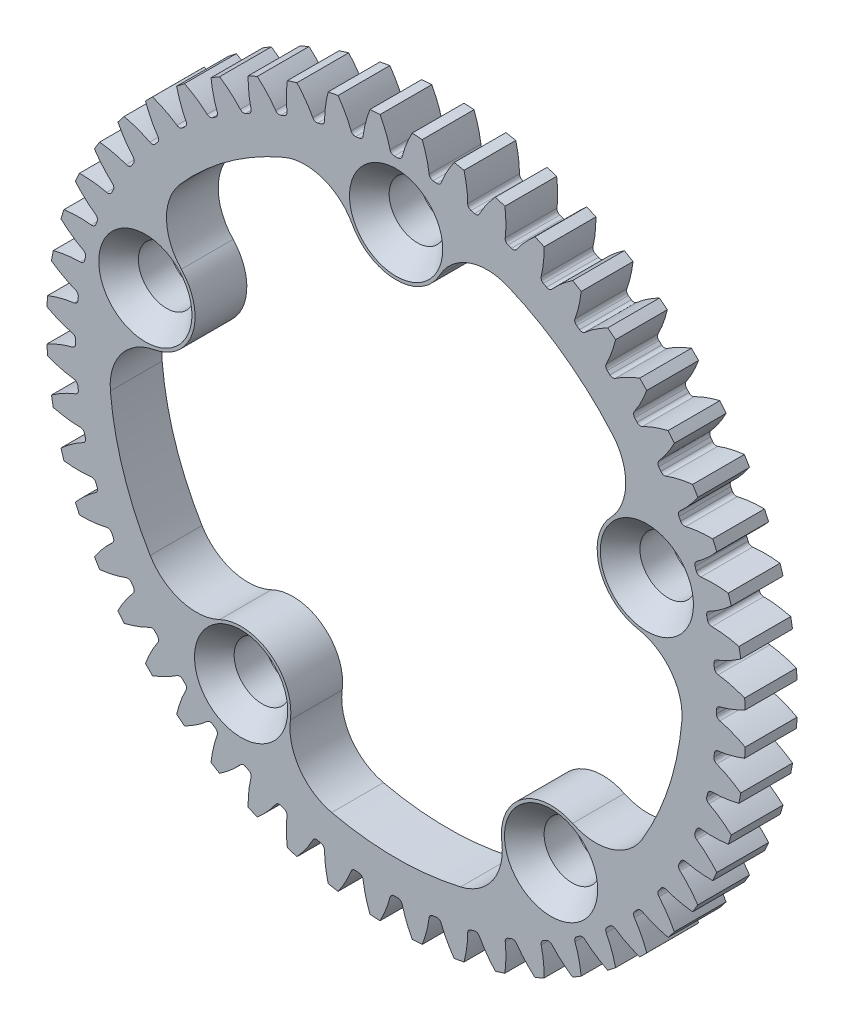
from build123d import *

# Parameters (mm, degrees)
SKETCH1_R                                     = 21.43125
BOSS_EXTRUDE1_DEPTH                           = 3.175
CUT_EXTRUDE1_REACH                            = 32.474
FILLET1_R                                     = 0.266307122
CIRPATTERN1_COUNT                             = 52
FILLET1_OF_CIRPATTERN1_R                      = 0.266307122
CUT_EXTRUDE2_REACH                            = 32.442
CSK_FOR_4_FLAT_HEAD_MACHINE_SCREW1_AT_2_COUNT = 2
CSK_FOR_4_FLAT_HEAD_MACHINE_SCREW1_AT_2_PITCH = 19.005565905
CSK_FOR_4_FLAT_HEAD_MACHINE_SCREW1_AT_3_COUNT = 2
CSK_FOR_4_FLAT_HEAD_MACHINE_SCREW1_AT_3_PITCH = 30.751651609
CSK_FOR_4_FLAT_HEAD_MACHINE_SCREW1_AT_4_COUNT = 2
CSK_FOR_4_FLAT_HEAD_MACHINE_SCREW1_AT_4_PITCH = 30.751651609
CSK_FOR_4_FLAT_HEAD_MACHINE_SCREW1_AT_5_COUNT = 2
CSK_FOR_4_FLAT_HEAD_MACHINE_SCREW1_AT_5_PITCH = 19.005565905


with BuildPart() as part:
    # Sketch1 → Boss-Extrude1 (new body)
    with BuildSketch(Plane.XY):
        Circle(SKETCH1_R)
    extrude(amount=-BOSS_EXTRUDE1_DEPTH)

    # Sketch2 → Cut-Extrude1 (cut, up to next)
    with BuildSketch(Plane.XY, mode=Mode.PRIVATE) as cut_extrude1_sk1:
        with BuildLine():
            ThreePointArc((19.642574739, 0.327964689), (19.642798219, 0.314294998), (19.643012186, 0.300625155))
            ThreePointArc((19.643012186, 0.300625155), (19.644737413, 0.150316978), (19.6453125, 0))
            ThreePointArc((19.6453125, 0), (19.644737413, -0.150316978), (19.643012186, -0.300625155))
            ThreePointArc((19.643012186, -0.300625155), (19.642798219, -0.314294998), (19.642574739, -0.327964689))
            add(Edge.make_bspline(
                [(19.642574739, -0.327964689), (19.65835543, -0.33079196), (19.704727828, -0.339425059), (19.796499822, -0.358275647), (19.933064852, -0.390982616), (20.097906156, -0.436744542), (20.275912073, -0.492991017), (20.430610013, -0.54721969), (20.54031096, -0.588677295), (20.605948953, -0.614496658), (20.628084749, -0.623318401)],
                knots=[0.037216085, 0.037216085, 0.037216085, 0.037216085, 0.037216085, 0.046610139, 0.064854849, 0.092110525, 0.119476176, 0.146842496, 0.174208854, 0.188172962, 0.188172962, 0.188172962, 0.188172962, 0.188172962], degree=4))
            ThreePointArc((20.628084749, -0.623318401), (20.635146053, -0.311694753), (20.6375, 0))
            ThreePointArc((20.6375, 0), (20.635146053, 0.311694753), (20.628084749, 0.623318401))
            add(Edge.make_bspline(
                [(19.642574739, 0.327964689), (19.65835543, 0.33079196), (19.704727828, 0.339425059), (19.796499822, 0.358275647), (19.933064852, 0.390982616), (20.097906156, 0.436744542), (20.275912073, 0.492991017), (20.430610013, 0.54721969), (20.54031096, 0.588677295), (20.605948953, 0.614496658), (20.628084749, 0.623318401)],
                knots=[0.037216085, 0.037216085, 0.037216085, 0.037216085, 0.037216085, 0.046610139, 0.064854849, 0.092110525, 0.119476176, 0.146842496, 0.174208854, 0.188172962, 0.188172962, 0.188172962, 0.188172962, 0.188172962], degree=4))
        make_face()
    cut_extrude1_tool1 = extrude(cut_extrude1_sk1.sketch, amount=-CUT_EXTRUDE1_REACH, mode=Mode.PRIVATE) & part.part
    # Sketch2 → Cut-Extrude1 (cut, up to next)
    with BuildSketch(Plane.XY, mode=Mode.PRIVATE) as cut_extrude1_sk2:
        with BuildLine():
            add(Edge.make_bspline(
                [(20.628084749, 0.623318401), (20.649329486, 0.631785031), (20.713839892, 0.657815411), (20.821075484, 0.702694452), (21.006667214, 0.78497796), (21.179989773, 0.867942113), (21.309988998, 0.933914245), (21.397615643, 0.979985824), (21.408566897, 0.985768727)],
                knots=[0.188172962, 0.188172962, 0.188172962, 0.188172962, 0.188172962, 0.201574956, 0.228941013, 0.256307345, 0.307035032, 0.314288545, 0.314288545, 0.314288545, 0.314288545, 0.314288545], degree=4))
            ThreePointArc((20.628084749, 0.623318401), (20.635146053, 0.311694753), (20.6375, 0))
            ThreePointArc((20.6375, 0), (20.635146053, -0.311694753), (20.628084749, -0.623318401))
            add(Edge.make_bspline(
                [(20.628084749, -0.623318401), (20.649329486, -0.631785031), (20.713839892, -0.657815411), (20.821075484, -0.702694452), (21.006667214, -0.78497796), (21.179989773, -0.867942113), (21.309988998, -0.933914245), (21.397615643, -0.979985824), (21.408566897, -0.985768727)],
                knots=[0.188172962, 0.188172962, 0.188172962, 0.188172962, 0.188172962, 0.201574956, 0.228941013, 0.256307345, 0.307035032, 0.314288545, 0.314288545, 0.314288545, 0.314288545, 0.314288545], degree=4))
            ThreePointArc((21.408566897, -0.985768727), (21.425578474, -0.493014834), (21.43125, 0))
            ThreePointArc((21.43125, 0), (21.425578474, 0.493014834), (21.408566897, 0.985768727))
        make_face()
    cut_extrude1_tool2 = extrude(cut_extrude1_sk2.sketch, amount=-CUT_EXTRUDE1_REACH, mode=Mode.PRIVATE) & part.part
    cut_extrude1_1 = cut_extrude1_tool1.solids().sort_by_distance((20.193172, 0, 0))[0]
    add(cut_extrude1_1, mode=Mode.SUBTRACT)
    cut_extrude1_2 = cut_extrude1_tool2.solids().sort_by_distance((21.059239, 0, 0))[0]
    add(cut_extrude1_2, mode=Mode.SUBTRACT)
    cut_extrude1 = cut_extrude1_1 + cut_extrude1_2  # Cut-Extrude1 as one shape, for the pattern or mirror that repeats it

    # Fillet1
    fillet1_edges = [part.edges().sort_by_distance(p)[0] for p in [
        (19.642574739, -0.327964689, -1.5875),
        (19.642574739, 0.327964689, -1.5875),
    ]]
    fillet(fillet1_edges, radius=FILLET1_R)

    # CirPattern1: Cut-Extrude1 ×52 about axis
    cirpattern1_axis = Axis((0, 0, 0), (0, 0, 1))
    for i in range(1, CIRPATTERN1_COUNT):
        add(cut_extrude1.rotate(cirpattern1_axis, i * 360 / CIRPATTERN1_COUNT), mode=Mode.SUBTRACT)

    # Fillet1 of CirPattern1
    fillet1_of_cirpattern1_edges = [part.edges().sort_by_distance(p)[0] for p in [
        (19.538890029, 2.042077294, -1.5875),
        (19.459826479, 2.693224208, -1.5875),
        (19.150284304, 4.382341191, -1.5875),
        (18.993310129, 5.019210453, -1.5875),
        (18.482424311, 6.658700686, -1.5875),
        (18.249828548, 7.272005308, -1.5875),
        (17.545048953, 8.83796133, -1.5875),
        (17.240223372, 9.41875795, -1.5875),
        (16.351827273, 10.888344597, -1.5875),
        (15.979216917, 11.428163892, -1.5875),
        (14.92015913, 12.779951281, -1.5875),
        (14.485197498, 13.27092147, -1.5875),
        (13.27092147, 14.485197498, -1.5875),
        (12.779951281, 14.92015913, -1.5875),
        (11.428163892, 15.979216917, -1.5875),
        (10.888344597, 16.351827273, -1.5875),
        (9.41875795, 17.240223372, -1.5875),
        (8.83796133, 17.545048953, -1.5875),
        (7.272005308, 18.249828548, -1.5875),
        (6.658700686, 18.482424311, -1.5875),
        (5.019210453, 18.993310129, -1.5875),
        (4.382341191, 19.150284304, -1.5875),
        (2.693224208, 19.459826479, -1.5875),
        (2.042077294, 19.538890029, -1.5875),
        (0.327964689, 19.642574739, -1.5875),
        (-0.327964689, 19.642574739, -1.5875),
        (-2.042077294, 19.538890029, -1.5875),
        (-2.693224208, 19.459826479, -1.5875),
        (-4.382341191, 19.150284304, -1.5875),
        (-5.019210453, 18.993310129, -1.5875),
        (-6.658700686, 18.482424311, -1.5875),
        (-7.272005308, 18.249828548, -1.5875),
        (-8.83796133, 17.545048953, -1.5875),
        (-9.41875795, 17.240223372, -1.5875),
        (-10.888344597, 16.351827273, -1.5875),
        (-11.428163892, 15.979216917, -1.5875),
        (-12.779951281, 14.92015913, -1.5875),
        (-13.27092147, 14.485197498, -1.5875),
        (-14.485197498, 13.27092147, -1.5875),
        (-14.92015913, 12.779951281, -1.5875),
        (-15.979216917, 11.428163892, -1.5875),
        (-16.351827273, 10.888344597, -1.5875),
        (-17.240223372, 9.41875795, -1.5875),
        (-17.545048953, 8.83796133, -1.5875),
        (-18.249828548, 7.272005308, -1.5875),
        (-18.482424311, 6.658700686, -1.5875),
        (-18.993310129, 5.019210453, -1.5875),
        (-19.150284304, 4.382341191, -1.5875),
        (-19.459826479, 2.693224208, -1.5875),
        (-19.538890029, 2.042077294, -1.5875),
        (-19.642574739, 0.327964689, -1.5875),
        (-19.642574739, -0.327964689, -1.5875),
        (-19.538890029, -2.042077294, -1.5875),
        (-19.459826479, -2.693224208, -1.5875),
        (-19.150284304, -4.382341191, -1.5875),
        (-18.993310129, -5.019210453, -1.5875),
        (-18.482424311, -6.658700686, -1.5875),
        (-18.249828548, -7.272005308, -1.5875),
        (-17.545048953, -8.83796133, -1.5875),
        (-17.240223372, -9.41875795, -1.5875),
        (-16.351827273, -10.888344597, -1.5875),
        (-15.979216917, -11.428163892, -1.5875),
        (-14.92015913, -12.779951281, -1.5875),
        (-14.485197498, -13.27092147, -1.5875),
        (-13.27092147, -14.485197498, -1.5875),
        (-12.779951281, -14.92015913, -1.5875),
        (-11.428163892, -15.979216917, -1.5875),
        (-10.888344597, -16.351827273, -1.5875),
        (-9.41875795, -17.240223372, -1.5875),
        (-8.83796133, -17.545048953, -1.5875),
        (-7.272005308, -18.249828548, -1.5875),
        (-6.658700686, -18.482424311, -1.5875),
        (-5.019210453, -18.993310129, -1.5875),
        (-4.382341191, -19.150284304, -1.5875),
        (-2.693224208, -19.459826479, -1.5875),
        (-2.042077294, -19.538890029, -1.5875),
        (-0.327964689, -19.642574739, -1.5875),
        (0.327964689, -19.642574739, -1.5875),
        (2.042077294, -19.538890029, -1.5875),
        (2.693224208, -19.459826479, -1.5875),
        (4.382341191, -19.150284304, -1.5875),
        (5.019210453, -18.993310129, -1.5875),
        (6.658700686, -18.482424311, -1.5875),
        (7.272005308, -18.249828548, -1.5875),
        (8.83796133, -17.545048953, -1.5875),
        (9.41875795, -17.240223372, -1.5875),
        (10.888344597, -16.351827273, -1.5875),
        (11.428163892, -15.979216917, -1.5875),
        (12.779951281, -14.92015913, -1.5875),
        (13.27092147, -14.485197498, -1.5875),
        (14.485197498, -13.27092147, -1.5875),
        (14.92015913, -12.779951281, -1.5875),
        (15.979216917, -11.428163892, -1.5875),
        (16.351827273, -10.888344597, -1.5875),
        (17.240223372, -9.41875795, -1.5875),
        (17.545048953, -8.83796133, -1.5875),
        (18.249828548, -7.272005308, -1.5875),
        (18.482424311, -6.658700686, -1.5875),
        (18.993310129, -5.019210453, -1.5875),
        (19.150284304, -4.382341191, -1.5875),
        (19.459826479, -2.693224208, -1.5875),
        (19.538890029, -2.042077294, -1.5875),
    ]]
    fillet(fillet1_of_cirpattern1_edges, radius=FILLET1_OF_CIRPATTERN1_R)

    # Sketch4 → Cut-Extrude2 (cut, up to next)
    with BuildSketch(Plane.XY, mode=Mode.PRIVATE) as cut_extrude2_sk1:
        with BuildLine():
            ThreePointArc((15.080396195, -9.053847847), (16.728608593, -5.435454423), (17.522015045, -1.539317709))
            ThreePointArc((17.522015045, -1.539317709), (16.859191088, 0.750817077), (14.827117595, 1.997705304))
            ThreePointArc((14.827117595, 1.997705304), (12.477005543, 4.054024851), (13.169611828, 7.098983515))
            ThreePointArc((13.169611828, 7.098983515), (14.080691307, 9.302160113), (13.270819699, 11.544516221))
            ThreePointArc((13.270819699, 11.544516221), (10.338848695, 14.230204423), (6.878578563, 16.188751255))
            ThreePointArc((6.878578563, 16.188751255), (4.495707084, 16.26605878), (2.681900667, 14.718751695))
            ThreePointArc((2.681900667, 14.718751695), (0, 13.1191), (-2.681900667, 14.718751695))
            ThreePointArc((-2.681900667, 14.718751695), (-4.495707084, 16.26605878), (-6.878578563, 16.188751255))
            ThreePointArc((-6.878578563, 16.188751255), (-10.338848695, 14.230204423), (-13.270819699, 11.544516221))
            ThreePointArc((-13.270819699, 11.544516221), (-14.080691307, 9.302160113), (-13.169611828, 7.098983515))
            ThreePointArc((-13.169611828, 7.098983515), (-12.477005543, 4.054024851), (-14.827117595, 1.997705304))
            ThreePointArc((-14.827117595, 1.997705304), (-16.859191088, 0.750817077), (-17.522015045, -1.539317709))
            ThreePointArc((-17.522015045, -1.539317709), (-16.728608593, -5.435454423), (-15.080396195, -9.053847847))
            ThreePointArc((-15.080396195, -9.053847847), (-13.198052897, -10.517007662), (-10.821168395, -10.331338597))
            ThreePointArc((-10.821168395, -10.331338597), (-7.711213503, -10.613574851), (-6.481761962, -13.484101918))
            ThreePointArc((-6.481761962, -13.484101918), (-5.923846031, -15.802028308), (-3.950622286, -17.140101919))
            ThreePointArc((-3.950622286, -17.140101919), (0, -17.5895), (3.950622286, -17.140101919))
            ThreePointArc((3.950622286, -17.140101919), (5.923846031, -15.802028308), (6.481761962, -13.484101918))
            ThreePointArc((6.481761962, -13.484101918), (7.711213503, -10.613574851), (10.821168395, -10.331338597))
            ThreePointArc((10.821168395, -10.331338597), (13.198052897, -10.517007662), (15.080396195, -9.053847847))
        make_face()
    cut_extrude2_tool1 = extrude(cut_extrude2_sk1.sketch, amount=-CUT_EXTRUDE2_REACH, mode=Mode.PRIVATE) & part.part
    add(cut_extrude2_tool1.solids().sort_by_distance((0, 0, 0))[0], mode=Mode.SUBTRACT)

    # Sketch7 → CSK for #4 Flat Head Machine Screw1 (revolve, cut)
    with BuildSketch(Plane(origin=(0, 16.1671, 0), x_dir=(0, -1, 0), z_dir=(1, 0, 0))):
        Polygon((0, 0), (0, 3.175), (1.7272, 3.175), (1.7272, 1.300261411), (2.8575, 0), align=None)
    csk_for_4_flat_head_machine_screw1 = revolve(axis=Axis((0, 16.1671, 6.35), (0, 0, -1)), mode=Mode.SUBTRACT)

    # CSK for #4 Flat Head Machine Screw1 at 2: CSK for #4 Flat Head Machine Screw1 ×2
    with Locations(*[Vector(0.8090169943749466, -0.5877852522924744, 0) * (i * CSK_FOR_4_FLAT_HEAD_MACHINE_SCREW1_AT_2_PITCH) for i in range(1, CSK_FOR_4_FLAT_HEAD_MACHINE_SCREW1_AT_2_COUNT)]):
        add(csk_for_4_flat_head_machine_screw1, mode=Mode.SUBTRACT)

    # CSK for #4 Flat Head Machine Screw1 at 3: CSK for #4 Flat Head Machine Screw1 ×2
    with Locations(*[Vector(0.3090169943749446, -0.9510565162951545, 0) * (i * CSK_FOR_4_FLAT_HEAD_MACHINE_SCREW1_AT_3_PITCH) for i in range(1, CSK_FOR_4_FLAT_HEAD_MACHINE_SCREW1_AT_3_COUNT)]):
        add(csk_for_4_flat_head_machine_screw1, mode=Mode.SUBTRACT)

    # CSK for #4 Flat Head Machine Screw1 at 4: CSK for #4 Flat Head Machine Screw1 ×2
    with Locations(*[Vector(-0.30901699437495167, -0.9510565162951522, 0) * (i * CSK_FOR_4_FLAT_HEAD_MACHINE_SCREW1_AT_4_PITCH) for i in range(1, CSK_FOR_4_FLAT_HEAD_MACHINE_SCREW1_AT_4_COUNT)]):
        add(csk_for_4_flat_head_machine_screw1, mode=Mode.SUBTRACT)

    # CSK for #4 Flat Head Machine Screw1 at 5: CSK for #4 Flat Head Machine Screw1 ×2
    with Locations(*[Vector(-0.8090169943749509, -0.5877852522924685, 0) * (i * CSK_FOR_4_FLAT_HEAD_MACHINE_SCREW1_AT_5_PITCH) for i in range(1, CSK_FOR_4_FLAT_HEAD_MACHINE_SCREW1_AT_5_COUNT)]):
        add(csk_for_4_flat_head_machine_screw1, mode=Mode.SUBTRACT)


solid = part.part
